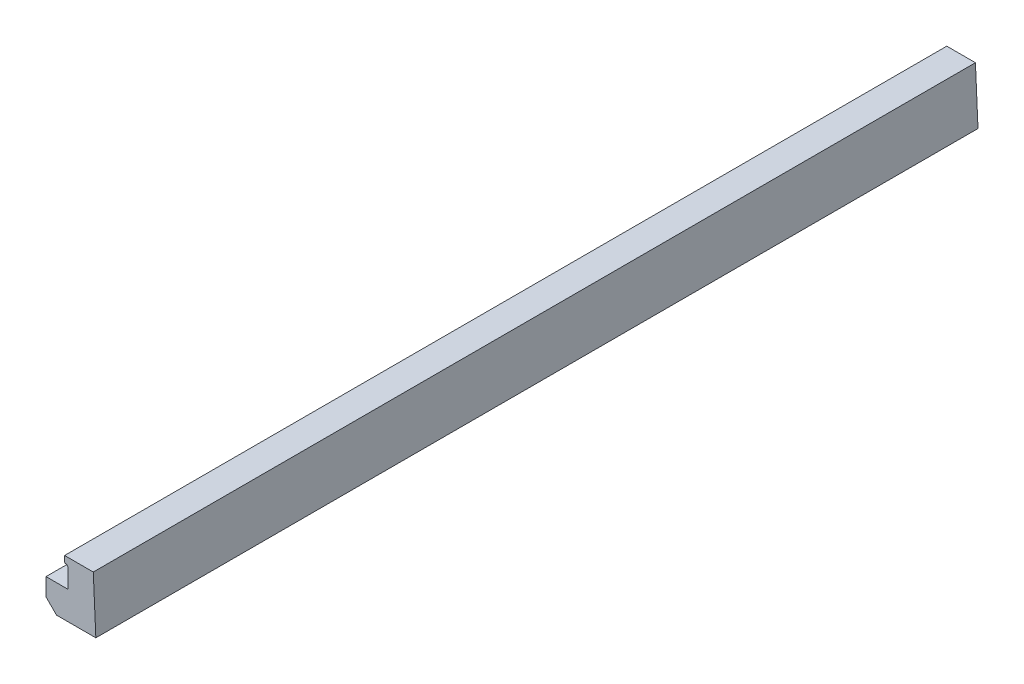
from build123d import *

# Parameters (mm, degrees)
Y_RAIL_SLOT_DEPTH      = 45
Y_RAIL_CONT_DEPTH      = 2
Z_RAIL_SLOT_DEPTH      = 45
X_RAIL_SLOT_DEPTH      = 45
TOLERANCE_START        = -45
TOLERANCE_CUT_Z_DEPTH  = 45
TOLERANCE_CUT_Y_DEPTH  = 135.627263211
TOLERANCE_CUT_X_DEPTH  = 45
SHARP_CORNER_FILLETS_R = 0.2
CUT_EXTRUDE1_DEPTH     = 135.627263211
CUT_EXTRUDE2_START     = -45
CUT_EXTRUDE2_DEPTH     = 45
SKETCH25_W             = 5.05
SKETCH25_H             = 4.200000003
SKETCH25_W_2           = 5.050000001
SKETCH25_H_2           = 4.200000002
SKETCH25_W_3           = 19.75
SKETCH25_H_3           = 19.75
CUT_EXTRUDE3_DEPTH     = 118.874933721
FILLET1_R              = 0.4
CUT_EXTRUDE4_DEPTH     = 118.874933721
BOSS_EXTRUDE1_START    = 109.45
BOSS_EXTRUDE1_DEPTH    = 109.45


with BuildPart() as part:
    # Sketch10 → Y-Rail Slot (new, symmetric)
    with BuildSketch(Plane.XY):
        with BuildLine():
            ThreePointArc((22, -5.8), (22.353553391, -5.946446609), (22.5, -6.3))
            Line((22.5, -6.3), (22.5, -19.5))
            ThreePointArc((22.5, -19.5), (21.621320343, -21.621320344), (19.499999999, -22.500000001))
            Line((19.499999999, -22.500000001), (24.499999999, -22.500000001))
            Line((24.499999999, -22.500000001), (24.499999999, 24.499999999))
            Line((24.499999999, 24.499999999), (-22.500000001, 24.499999999))
            Line((-22.500000001, 24.499999999), (-22.500000001, 19.500000001))
            ThreePointArc((-22.500000001, 19.500000001), (-21.621320345, 21.621320345), (-19.500000001, 22.500000001))
            Line((-19.500000001, 22.500000001), (-6.300000002, 22.500000001))
            ThreePointArc((-6.300000002, 22.500000001), (-5.946446612, 22.353553392), (-5.800000002, 22.000000001))
            Line((-5.800000002, 22.000000001), (-5.800000002, 21.000000004))
            Line((-5.800000002, 21.000000004), (-5.499999997, 21.000000004))
            ThreePointArc((-5.499999997, 21.000000004), (-5.146446607, 20.853553394), (-4.999999997, 20.500000004))
            Line((-4.999999997, 20.500000004), (-4.999999997, 17.525000004))
            ThreePointArc((-4.999999997, 17.525000004), (-5.146446607, 17.171446613), (-5.499999997, 17.025000004))
            Line((-5.499999997, 17.025000004), (-9.549999997, 17.025000004))
            ThreePointArc((-9.549999997, 17.025000004), (-9.903553388, 16.878553395), (-10.049999997, 16.525000004))
            Line((-10.049999997, 16.525000004), (-10.049999997, 11.757106781))
            ThreePointArc((-10.049999997, 11.757106781), (-10.011939764, 11.565765065), (-9.903553388, 11.403553391))
            Line((-9.903553388, 11.403553391), (-6.499999999, 8.000000002))
            Line((-6.499999998, 8.000000003), (2e-09, 8.000000003))
            Line((2e-09, 8.000000003), (6.500000002, 8.000000003))
            Line((6.500000002, 8.000000003), (9.903553392, 11.403553393))
            ThreePointArc((9.903553392, 11.403553393), (10.011939767, 11.565765067), (10.050000001, 11.757106783))
            Line((10.050000001, 11.757106783), (10.050000001, 16.525000003))
            ThreePointArc((10.050000001, 16.525000003), (9.903553392, 16.878553394), (9.550000001, 17.025000003))
            Line((9.550000001, 17.025000003), (5.5, 17.025000003))
            ThreePointArc((5.5, 17.025000003), (5.146446609, 17.171446613), (5, 17.525000003))
            Line((5, 17.525000003), (5, 20.500000003))
            ThreePointArc((5, 20.500000003), (5.146446609, 20.853553393), (5.5, 21.000000003))
            Line((5.5, 21.000000003), (5.800000001, 21.000000003))
            Line((5.800000001, 21.000000003), (5.800000001, 22.000000001))
            ThreePointArc((5.800000001, 22.000000001), (5.94644661, 22.353553392), (6.300000001, 22.500000001))
            Line((6.300000001, 22.500000001), (19.500000001, 22.500000001))
            ThreePointArc((19.500000001, 22.500000001), (21.621320345, 21.621320345), (22.500000001, 19.500000001))
            Line((22.500000001, 19.500000001), (22.500000001, 6.300000002))
            ThreePointArc((22.500000001, 6.300000002), (22.353553392, 5.946446612), (22.000000001, 5.800000002))
            Line((22.000000001, 5.800000002), (21.000000002, 5.800000002))
            Line((21.000000002, 5.800000002), (21.000000002, 5.500000005))
            ThreePointArc((21.000000002, 5.500000005), (20.853553393, 5.146446614), (20.500000002, 5.000000005))
            Line((20.500000002, 5.000000005), (17.525000003, 5.000000005))
            ThreePointArc((17.525000003, 5.000000005), (17.171446612, 5.146446614), (17.025000003, 5.500000005))
            Line((17.025000003, 5.500000005), (17.025000003, 10.050000003))
            Line((17.025000003, 10.050000003), (11.757106782, 10.050000003))
            ThreePointArc((11.757106782, 10.050000003), (11.565765066, 10.011939769), (11.403553391, 9.903553394))
            Line((11.403553391, 9.903553394), (8.000000002, 6.500000004))
            Line((8.000000001, 6.500000005), (8.000000001, 3e-09))
            Line((8.000000001, 3e-09), (8.000000001, -6.499999999))
            Line((8.000000001, -6.499999999), (11.40355339, -9.903553388))
            ThreePointArc((11.40355339, -9.903553388), (11.565765064, -10.011939763), (11.75710678, -10.049999997))
            Line((11.75710678, -10.049999997), (16.525, -10.049999997))
            ThreePointArc((16.525, -10.049999997), (16.878553391, -9.903553388), (17.025000001, -9.549999997))
            Line((17.025000001, -9.549999997), (17.025000001, -5.499999996))
            ThreePointArc((17.025000001, -5.499999996), (17.17144661, -5.146446605), (17.525000001, -4.999999996))
            Line((17.525000001, -4.999999996), (20.5, -4.999999996))
            ThreePointArc((20.5, -4.999999996), (20.853553391, -5.146446605), (21, -5.499999996))
            Line((21, -5.499999996), (21, -5.8))
            Line((21, -5.8), (22, -5.8))
        make_face()
    extrude(amount=Y_RAIL_SLOT_DEPTH, both=True)

    # Sketch12 → Y-Rail cont. (add)
    with BuildSketch(Plane(origin=(0, 0, -45), x_dir=(-1, 0, 0), z_dir=(0, 0, -1))):
        with BuildLine():
            Line((-22.5, -19.5), (-22.5, -6.3))
            ThreePointArc((-22.5, -6.3), (-22.353553391, -5.946446609), (-22, -5.8))
            Line((-22, -5.8), (-21, -5.8))
            Line((-21, -5.8), (-21, -5.499999996))
            ThreePointArc((-21, -5.499999996), (-20.853553391, -5.146446605), (-20.5, -4.999999996))
            Line((-20.5, -4.999999996), (-17.525000001, -4.999999996))
            ThreePointArc((-17.525000001, -4.999999996), (-17.17144661, -5.146446605), (-17.025000001, -5.499999996))
            Line((-17.025000001, -5.499999996), (-17.025000001, -9.549999997))
            ThreePointArc((-17.025000001, -9.549999997), (-16.878553391, -9.903553388), (-16.525, -10.049999997))
            Line((-16.525, -10.049999997), (-11.75710678, -10.049999997))
            ThreePointArc((-11.75710678, -10.049999997), (-11.565765064, -10.011939763), (-11.40355339, -9.903553388))
            Line((-11.40355339, -9.903553388), (-8.000000001, -6.499999999))
            Line((-8.000000001, -6.499999999), (-8.000000001, 6.500000003))
            Line((-8.000000001, 6.500000003), (-11.403553391, 9.903553394))
            ThreePointArc((-11.403553391, 9.903553394), (-11.565765066, 10.011939769), (-11.757106782, 10.050000003))
            Line((-11.757106782, 10.050000003), (-17.025000003, 10.050000003))
            Line((-17.025000003, 10.050000003), (-17.025000003, 5.500000005))
            ThreePointArc((-17.025000003, 5.500000005), (-17.171446612, 5.146446614), (-17.525000003, 5.000000005))
            Line((-17.525000003, 5.000000005), (-20.500000002, 5.000000005))
            ThreePointArc((-20.500000002, 5.000000005), (-20.853553393, 5.146446614), (-21.000000002, 5.500000005))
            Line((-21.000000002, 5.500000005), (-21.000000002, 5.800000002))
            Line((-21.000000002, 5.800000002), (-22.000000001, 5.800000002))
            ThreePointArc((-22.000000001, 5.800000002), (-22.353553392, 5.946446612), (-22.500000001, 6.300000002))
            Line((-22.500000001, 6.300000002), (-22.500000001, 19.500000001))
            ThreePointArc((-22.500000001, 19.500000001), (-21.621320345, 21.621320345), (-19.500000001, 22.500000001))
            Line((-19.500000001, 22.500000001), (-6.300000001, 22.500000001))
            ThreePointArc((-6.300000001, 22.500000001), (-5.94644661, 22.353553392), (-5.800000001, 22.000000001))
            Line((-5.800000001, 22.000000001), (-5.800000001, 21.000000003))
            Line((-5.800000001, 21.000000003), (-5.5, 21.000000003))
            ThreePointArc((-5.5, 21.000000003), (-5.146446609, 20.853553393), (-5, 20.500000003))
            Line((-5, 20.500000003), (-5, 17.525000003))
            ThreePointArc((-5, 17.525000003), (-5.146446609, 17.171446613), (-5.5, 17.025000003))
            Line((-5.5, 17.025000003), (-9.550000001, 17.025000003))
            ThreePointArc((-9.550000001, 17.025000003), (-9.903553392, 16.878553394), (-10.050000001, 16.525000003))
            Line((-10.050000001, 16.525000003), (-10.050000001, 11.757106783))
            ThreePointArc((-10.050000001, 11.757106783), (-10.011939767, 11.565765067), (-9.903553392, 11.403553393))
            Line((-9.903553392, 11.403553393), (-6.500000002, 8.000000003))
            Line((-6.500000002, 8.000000003), (6.5, 8.000000003))
            Line((6.5, 8.000000003), (9.903553388, 11.403553391))
            ThreePointArc((9.903553388, 11.403553391), (10.011939764, 11.565765065), (10.049999997, 11.757106781))
            Line((10.049999997, 11.757106781), (10.049999997, 16.525000004))
            ThreePointArc((10.049999997, 16.525000004), (9.903553388, 16.878553395), (9.549999997, 17.025000004))
            Line((9.549999997, 17.025000004), (5.499999997, 17.025000004))
            ThreePointArc((5.499999997, 17.025000004), (5.146446607, 17.171446613), (4.999999997, 17.525000004))
            Line((4.999999997, 17.525000004), (4.999999997, 20.500000004))
            ThreePointArc((4.999999997, 20.500000004), (5.146446607, 20.853553394), (5.499999997, 21.000000004))
            Line((5.499999997, 21.000000004), (5.800000002, 21.000000004))
            Line((5.800000002, 21.000000004), (5.800000002, 22.000000001))
            ThreePointArc((5.800000002, 22.000000001), (5.946446612, 22.353553392), (6.300000002, 22.500000001))
            Line((6.300000002, 22.500000001), (19.500000001, 22.500000001))
            ThreePointArc((19.500000001, 22.500000001), (21.621320345, 21.621320345), (22.500000001, 19.500000001))
            Line((22.500000001, 19.500000001), (22.500000001, 24.499999999))
            Line((22.500000001, 24.499999999), (-24.499999999, 24.499999999))
            Line((-24.499999999, 24.499999999), (-24.499999999, -22.500000001))
            Line((-24.499999999, -22.500000001), (-19.499999999, -22.500000001))
            ThreePointArc((-19.499999999, -22.500000001), (-21.621320343, -21.621320344), (-22.5, -19.5))
        make_face()
    extrude(amount=Y_RAIL_CONT_DEPTH)

    # Sketch17 → Z-Rail Slot (add)
    with BuildSketch(Plane(origin=(0, 24.499999999, 0), x_dir=(1, 0, 0), z_dir=(0, 1, 0))):
        with BuildLine():
            Line((19.499999999, -45), (24.499999999, -45))
            Line((24.499999999, -45), (24.499999999, 2))
            Line((24.499999999, 2), (-22.500000001, 2))
            Line((-22.500000001, 2), (-22.500000001, -2.999999998))
            ThreePointArc((-22.500000001, -2.999999998), (-21.621320345, -0.878679654), (-19.500000001, 2e-09))
            Line((-19.500000001, 2e-09), (-6.300000002, 2e-09))
            ThreePointArc((-6.300000002, 2e-09), (-5.946446612, -0.146446607), (-5.800000002, -0.499999998))
            Line((-5.800000002, -0.499999998), (-5.800000002, -1.499999995))
            Line((-5.800000002, -1.499999995), (-5.499999997, -1.499999995))
            ThreePointArc((-5.499999997, -1.499999995), (-5.146446607, -1.646446605), (-4.999999997, -1.999999995))
            Line((-4.999999997, -1.999999995), (-4.999999997, -4.974999995))
            ThreePointArc((-4.999999997, -4.974999995), (-5.146446607, -5.328553385), (-5.499999997, -5.474999995))
            Line((-5.499999997, -5.474999995), (-9.549999997, -5.474999995))
            ThreePointArc((-9.549999997, -5.474999995), (-9.903553388, -5.621446604), (-10.049999997, -5.974999995))
            Line((-10.049999997, -5.974999995), (-10.049999997, -10.742893218))
            ThreePointArc((-10.049999997, -10.742893218), (-10.011939764, -10.934234934), (-9.903553388, -11.096446608))
            Line((-9.903553388, -11.096446608), (-6.5, -14.499999996))
            Line((-6.5, -14.499999996), (6.500000002, -14.499999996))
            Line((6.500000002, -14.499999996), (9.903553392, -11.096446606))
            ThreePointArc((9.903553392, -11.096446606), (10.011939767, -10.934234932), (10.050000001, -10.742893216))
            Line((10.050000001, -10.742893216), (10.050000001, -5.974999996))
            ThreePointArc((10.050000001, -5.974999996), (9.903553392, -5.621446605), (9.550000001, -5.474999996))
            Line((9.550000001, -5.474999996), (5.5, -5.474999996))
            ThreePointArc((5.5, -5.474999996), (5.146446609, -5.328553386), (5, -4.974999996))
            Line((5, -4.974999996), (5, -1.999999996))
            ThreePointArc((5, -1.999999996), (5.146446609, -1.646446606), (5.5, -1.499999996))
            Line((5.5, -1.499999996), (5.800000001, -1.499999996))
            Line((5.800000001, -1.499999996), (5.800000001, -0.499999998))
            ThreePointArc((5.800000001, -0.499999998), (5.94644661, -0.146446607), (6.300000001, 2e-09))
            Line((6.300000001, 2e-09), (19.500000001, 2e-09))
            ThreePointArc((19.500000001, 2e-09), (21.621320345, -0.878679654), (22.500000001, -2.999999998))
            Line((22.500000001, -2.999999998), (22.500000001, -16.199999997))
            ThreePointArc((22.500000001, -16.199999997), (22.353553392, -16.553553387), (22.000000001, -16.699999997))
            Line((22.000000001, -16.699999997), (21.000000002, -16.699999997))
            Line((21.000000002, -16.699999997), (21.000000002, -16.999999994))
            ThreePointArc((21.000000002, -16.999999994), (20.853553393, -17.353553385), (20.500000002, -17.499999994))
            Line((20.500000002, -17.499999994), (17.525000003, -17.499999994))
            ThreePointArc((17.525000003, -17.499999994), (17.171446612, -17.353553385), (17.025000003, -16.999999994))
            Line((17.025000003, -16.999999994), (17.025000003, -12.449999996))
            Line((17.025000003, -12.449999996), (11.757106782, -12.449999996))
            ThreePointArc((11.757106782, -12.449999996), (11.565765066, -12.48806023), (11.403553391, -12.596446605))
            Line((11.403553391, -12.596446605), (8.000000001, -15.999999995))
            Line((8.000000001, -15.999999995), (8.000000001, -28.999999998))
            Line((8.000000001, -28.999999998), (11.40355339, -32.403553387))
            ThreePointArc((11.40355339, -32.403553387), (11.565765064, -32.511939762), (11.75710678, -32.549999996))
            Line((11.75710678, -32.549999996), (16.525, -32.549999996))
            ThreePointArc((16.525, -32.549999996), (16.878553391, -32.403553386), (17.025000001, -32.049999996))
            Line((17.025000001, -32.049999996), (17.025000001, -27.999999995))
            ThreePointArc((17.025000001, -27.999999995), (17.17144661, -27.646446604), (17.525000001, -27.499999995))
            Line((17.525000001, -27.499999995), (20.5, -27.499999995))
            ThreePointArc((20.5, -27.499999995), (20.853553391, -27.646446604), (21, -27.999999995))
            Line((21, -27.999999995), (21, -28.299999999))
            Line((21, -28.299999999), (22, -28.299999999))
            ThreePointArc((22, -28.299999999), (22.353553391, -28.446446608), (22.5, -28.799999999))
            Line((22.5, -28.799999999), (22.5, -41.999999999))
            ThreePointArc((22.5, -41.999999999), (21.621320343, -44.121320343), (19.499999999, -45))
        make_face()
    extrude(amount=Z_RAIL_SLOT_DEPTH)

    # Sketch11 → X-Rail Slot (add)
    with BuildSketch(Plane(origin=(24.499999999, 0, 0), x_dir=(0, 0, -1), z_dir=(1, 0, 0))):
        with BuildLine():
            ThreePointArc((16.2, 22.5), (16.553553391, 22.353553391), (16.7, 22))
            Line((16.7, 22), (16.7, 21))
            Line((16.7, 21), (17, 21))
            ThreePointArc((17, 21), (17.353553391, 20.853553391), (17.5, 20.5))
            Line((17.5, 20.5), (17.5, 17.525))
            ThreePointArc((17.5, 17.525), (17.353553391, 17.171446609), (17, 17.025))
            Line((17, 17.025), (12.95, 17.025))
            ThreePointArc((12.95, 17.025), (12.596446609, 16.878553391), (12.45, 16.525))
            Line((12.45, 16.525), (12.45, 11.757106781))
            ThreePointArc((12.45, 11.757106781), (12.488060234, 11.565765065), (12.596446609, 11.403553391))
            Line((12.596446609, 11.403553391), (16, 8))
            Line((16, 8), (22.5, 8))
            Line((22.5, 8), (29, 8))
            Line((29, 8), (32.403553391, 11.403553391))
            ThreePointArc((32.403553391, 11.403553391), (32.511939766, 11.565765065), (32.55, 11.757106781))
            Line((32.55, 11.757106781), (32.55, 17.025))
            Line((32.55, 17.025), (28, 17.025))
            ThreePointArc((28, 17.025), (27.646446609, 17.171446609), (27.5, 17.525))
            Line((27.5, 17.525), (27.5, 20.5))
            ThreePointArc((27.5, 20.5), (27.646446609, 20.853553391), (28, 21))
            Line((28, 21), (28.3, 21))
            Line((28.3, 21), (28.3, 22))
            ThreePointArc((28.3, 22), (28.446446609, 22.353553391), (28.8, 22.5))
            Line((28.8, 22.5), (42, 22.5))
            ThreePointArc((42, 22.5), (44.121320344, 21.621320344), (45, 19.5))
            Line((45, 19.5), (45, 6.3))
            ThreePointArc((45, 6.3), (44.853553391, 5.946446609), (44.5, 5.8))
            Line((44.5, 5.8), (43.5, 5.8))
            Line((43.5, 5.8), (43.5, 5.5))
            ThreePointArc((43.5, 5.5), (43.353553391, 5.146446609), (43, 5))
            Line((43, 5), (40.025, 5))
            ThreePointArc((40.025, 5), (39.671446609, 5.146446609), (39.525, 5.5))
            Line((39.525, 5.5), (39.525, 9.55))
            ThreePointArc((39.525, 9.55), (39.378553391, 9.903553391), (39.025, 10.05))
            Line((39.025, 10.05), (34.257106781, 10.05))
            ThreePointArc((34.257106781, 10.05), (34.065765065, 10.011939766), (33.903553391, 9.903553391))
            Line((33.903553391, 9.903553391), (30.5, 6.5))
            Line((30.5, 6.5), (30.5, 0))
            Line((30.5, 0), (30.5, -6.5))
            Line((30.5, -6.5), (33.903553391, -9.903553391))
            ThreePointArc((33.903553391, -9.903553391), (34.065765065, -10.011939766), (34.257106781, -10.05))
            Line((34.257106781, -10.05), (39.025, -10.05))
            ThreePointArc((39.025, -10.05), (39.378553391, -9.903553391), (39.525, -9.55))
            Line((39.525, -9.55), (39.525, -5.5))
            ThreePointArc((39.525, -5.5), (39.671446609, -5.146446609), (40.025, -5))
            Line((40.025, -5), (43, -5))
            ThreePointArc((43, -5), (43.353553391, -5.146446609), (43.5, -5.5))
            Line((43.5, -5.5), (43.5, -5.8))
            Line((43.5, -5.8), (44.5, -5.8))
            ThreePointArc((44.5, -5.8), (44.853553391, -5.946446609), (45, -6.3))
            Line((45, -6.3), (45, -19.5))
            ThreePointArc((45, -19.5), (44.121320344, -21.621320344), (42, -22.5))
            Line((42, -22.5), (47, -22.500000001))
            Line((47, -22.500000001), (47, 24.499999999))
            Line((47, 24.499999999), (-45, 24.499999999))
            Line((-45, 24.499999999), (-45, 19.5))
            ThreePointArc((-45, 19.5), (-44.121320344, 21.621320344), (-42, 22.5))
            Line((-42, 22.5), (-28.8, 22.5))
            ThreePointArc((-28.8, 22.5), (-28.446446609, 22.353553391), (-28.3, 22))
            Line((-28.3, 22), (-28.3, 21))
            Line((-28.3, 21), (-28, 21))
            ThreePointArc((-28, 21), (-27.646446609, 20.853553391), (-27.5, 20.5))
            Line((-27.5, 20.5), (-27.5, 17.525))
            ThreePointArc((-27.5, 17.525), (-27.646446609, 17.171446609), (-28, 17.025))
            Line((-28, 17.025), (-32.55, 17.025))
            Line((-32.55, 17.025), (-32.55, 11.757106781))
            ThreePointArc((-32.55, 11.757106781), (-32.511939766, 11.565765065), (-32.403553391, 11.403553391))
            Line((-32.403553391, 11.403553391), (-29, 8))
            Line((-29, 8), (-22.5, 8))
            Line((-22.5, 8), (-16, 8))
            Line((-16, 8), (-12.596446609, 11.403553391))
            ThreePointArc((-12.596446609, 11.403553391), (-12.488060234, 11.565765065), (-12.45, 11.757106781))
            Line((-12.45, 11.757106781), (-12.45, 16.525))
            ThreePointArc((-12.45, 16.525), (-12.596446609, 16.878553391), (-12.95, 17.025))
            Line((-12.95, 17.025), (-17, 17.025))
            ThreePointArc((-17, 17.025), (-17.353553391, 17.171446609), (-17.5, 17.525))
            Line((-17.5, 17.525), (-17.5, 20.5))
            ThreePointArc((-17.5, 20.5), (-17.353553391, 20.853553391), (-17, 21))
            Line((-17, 21), (-16.7, 21))
            Line((-16.7, 21), (-16.7, 22))
            ThreePointArc((-16.7, 22), (-16.553553391, 22.353553391), (-16.2, 22.5))
            Line((-16.2, 22.5), (-7.8, 22.5))
            Line((-7.8, 22.5), (-7.8, 21.5))
            ThreePointArc((-7.8, 21.5), (-7.653553391, 21.146446609), (-7.3, 21))
            Line((-7.3, 21), (7.3, 21))
            ThreePointArc((7.3, 21), (7.653553391, 21.146446609), (7.8, 21.5))
            Line((7.8, 21.5), (7.8, 22.5))
            Line((7.8, 22.5), (16.2, 22.5))
        make_face()
    extrude(amount=X_RAIL_SLOT_DEPTH)

    # Sketch20 → Tolerance Cut Z (cut)
    with BuildSketch(Plane(origin=(0, 69.499999999, 0), x_dir=(1, 0, 0), z_dir=(0, 1, 0)).offset(TOLERANCE_START)):
        with BuildLine():
            ThreePointArc((-22.500000001, -2.999999998), (-21.621320345, -0.878679654), (-19.500000001, 2e-09))
            Line((-19.500000001, 2e-09), (-6.300000002, 2e-09))
            ThreePointArc((-6.300000002, 2e-09), (-5.946446612, -0.146446607), (-5.800000002, -0.499999998))
            Line((-5.800000002, -0.499999998), (-5.800000002, -1.499999995))
            Line((-5.800000002, -1.499999995), (-5.499999997, -1.499999995))
            ThreePointArc((-5.499999997, -1.499999995), (-5.146446607, -1.646446605), (-4.999999997, -1.999999995))
            Line((-4.999999997, -1.999999995), (-4.999999997, -4.974999995))
            ThreePointArc((-4.999999997, -4.974999995), (-5.146446607, -5.328553385), (-5.499999997, -5.474999995))
            Line((-5.499999997, -5.474999995), (-9.549999997, -5.474999995))
            ThreePointArc((-9.549999997, -5.474999995), (-9.903553388, -5.621446604), (-10.049999997, -5.974999995))
            Line((-10.049999997, -5.974999995), (-10.049999997, -10.742893218))
            ThreePointArc((-10.049999997, -10.742893218), (-10.011939764, -10.934234934), (-9.903553388, -11.096446608))
            Line((-9.903553388, -11.096446608), (-6.5, -14.499999996))
            Line((-6.5, -14.499999996), (6.500000002, -14.499999996))
            Line((6.500000002, -14.499999996), (9.903553392, -11.096446606))
            ThreePointArc((9.903553392, -11.096446606), (10.011939767, -10.934234932), (10.050000001, -10.742893216))
            Line((10.050000001, -10.742893216), (10.050000001, -5.974999996))
            ThreePointArc((10.050000001, -5.974999996), (9.903553392, -5.621446605), (9.550000001, -5.474999996))
            Line((9.550000001, -5.474999996), (5.5, -5.474999996))
            ThreePointArc((5.5, -5.474999996), (5.146446609, -5.328553386), (5, -4.974999996))
            Line((5, -4.974999996), (5, -1.999999996))
            ThreePointArc((5, -1.999999996), (5.146446609, -1.646446606), (5.5, -1.499999996))
            Line((5.5, -1.499999996), (5.800000001, -1.499999996))
            Line((5.800000001, -1.499999996), (5.800000001, -0.499999998))
            ThreePointArc((5.800000001, -0.499999998), (5.94644661, -0.146446607), (6.300000001, 2e-09))
            Line((6.300000001, 2e-09), (19.500000001, 2e-09))
            ThreePointArc((19.500000001, 2e-09), (21.621320345, -0.878679654), (22.500000001, -2.999999998))
            Line((22.500000001, -2.999999998), (22.500000001, -16.199999997))
            ThreePointArc((22.500000001, -16.199999997), (22.353553392, -16.553553387), (22.000000001, -16.699999997))
            Line((22.000000001, -16.699999997), (21.000000002, -16.699999997))
            Line((21.000000002, -16.699999997), (21.000000002, -16.999999994))
            ThreePointArc((21.000000002, -16.999999994), (20.853553393, -17.353553385), (20.500000002, -17.499999994))
            Line((20.500000002, -17.499999994), (17.525000003, -17.499999994))
            ThreePointArc((17.525000003, -17.499999994), (17.171446612, -17.353553385), (17.025000003, -16.999999994))
            Line((17.025000003, -16.999999994), (17.025000003, -12.449999996))
            Line((17.025000003, -12.449999996), (11.757106782, -12.449999996))
            ThreePointArc((11.757106782, -12.449999996), (11.565765066, -12.48806023), (11.403553391, -12.596446605))
            Line((11.403553391, -12.596446605), (8.000000001, -15.999999995))
            Line((8.000000001, -15.999999995), (8.000000001, -28.999999998))
            Line((8.000000001, -28.999999998), (11.40355339, -32.403553387))
            ThreePointArc((11.40355339, -32.403553387), (11.565765064, -32.511939762), (11.75710678, -32.549999996))
            Line((11.75710678, -32.549999996), (16.525, -32.549999996))
            ThreePointArc((16.525, -32.549999996), (16.878553391, -32.403553386), (17.025000001, -32.049999996))
            Line((17.025000001, -32.049999996), (17.025000001, -27.999999995))
            ThreePointArc((17.025000001, -27.999999995), (17.17144661, -27.646446604), (17.525000001, -27.499999995))
            Line((17.525000001, -27.499999995), (20.5, -27.499999995))
            ThreePointArc((20.5, -27.499999995), (20.853553391, -27.646446604), (21, -27.999999995))
            Line((21, -27.999999995), (21, -28.299999999))
            Line((21, -28.299999999), (22, -28.299999999))
            ThreePointArc((22, -28.299999999), (22.353553391, -28.446446608), (22.5, -28.799999999))
            Line((22.5, -28.799999999), (22.5, -41.999999999))
            ThreePointArc((22.5, -41.999999999), (21.621320343, -44.121320343), (19.499999999, -45))
            Line((19.499999999, -45), (19.499999999, -45.1))
            ThreePointArc((19.499999999, -45.1), (21.692031022, -44.192031021), (22.6, -41.999999999))
            Line((22.6, -41.999999999), (22.6, -28.799999999))
            ThreePointArc((22.6, -28.799999999), (22.424264069, -28.37573593), (22, -28.199999999))
            Line((22, -28.199999999), (21.1, -28.199999999))
            Line((21.1, -28.199999999), (21.1, -27.999999995))
            ThreePointArc((21.1, -27.999999995), (20.924264069, -27.575735926), (20.5, -27.399999995))
            Line((20.5, -27.399999995), (17.525000001, -27.399999995))
            ThreePointArc((17.525000001, -27.399999995), (17.100735932, -27.575735926), (16.925000001, -27.999999995))
            Line((16.925000001, -27.999999995), (16.925000001, -32.049999996))
            ThreePointArc((16.925000001, -32.049999996), (16.807842713, -32.332842708), (16.525, -32.449999996))
            Line((16.525, -32.449999996), (11.75710678, -32.449999996))
            ThreePointArc((11.75710678, -32.449999996), (11.604033408, -32.419551809), (11.474264068, -32.332842709))
            Line((11.474264068, -32.332842709), (8.100000001, -28.958578641))
            Line((8.100000001, -28.958578641), (8.100000001, -16.041421352))
            Line((8.100000001, -16.041421352), (11.474264069, -12.667157283))
            ThreePointArc((11.474264069, -12.667157283), (11.604033409, -12.580448183), (11.757106782, -12.549999996))
            Line((11.757106782, -12.549999996), (16.925000003, -12.549999996))
            Line((16.925000003, -12.549999996), (16.925000003, -16.999999994))
            ThreePointArc((16.925000003, -16.999999994), (17.100735934, -17.424264063), (17.525000003, -17.599999994))
            Line((17.525000003, -17.599999994), (20.500000002, -17.599999994))
            ThreePointArc((20.500000002, -17.599999994), (20.924264071, -17.424264063), (21.100000002, -16.999999994))
            Line((21.100000002, -16.999999994), (21.100000002, -16.799999997))
            Line((21.100000002, -16.799999997), (22.000000001, -16.799999997))
            ThreePointArc((22.000000001, -16.799999997), (22.42426407, -16.624264066), (22.600000001, -16.199999997))
            Line((22.600000001, -16.199999997), (22.600000001, -2.999999998))
            ThreePointArc((22.600000001, -2.999999998), (21.692031023, -0.807968976), (19.500000001, 0.100000002))
            Line((19.500000001, 0.100000002), (6.300000001, 0.100000002))
            ThreePointArc((6.300000001, 0.100000002), (5.875735932, -0.075735929), (5.700000001, -0.499999998))
            Line((5.700000001, -0.499999998), (5.700000001, -1.399999996))
            Line((5.700000001, -1.399999996), (5.5, -1.399999996))
            ThreePointArc((5.5, -1.399999996), (5.075735931, -1.575735927), (4.9, -1.999999996))
            Line((4.9, -1.999999996), (4.9, -4.974999996))
            ThreePointArc((4.9, -4.974999996), (5.075735931, -5.399264064), (5.5, -5.574999996))
            Line((5.5, -5.574999996), (9.550000001, -5.574999996))
            ThreePointArc((9.550000001, -5.574999996), (9.832842713, -5.692157283), (9.950000001, -5.974999996))
            Line((9.950000001, -5.974999996), (9.950000001, -10.742893216))
            ThreePointArc((9.950000001, -10.742893216), (9.919551814, -10.895966589), (9.832842714, -11.025735928))
            Line((9.832842714, -11.025735928), (6.458578646, -14.399999996))
            Line((6.458578646, -14.399999996), (-6.458578644, -14.399999996))
            Line((-6.458578644, -14.399999996), (-9.83284271, -11.02573593))
            ThreePointArc((-9.83284271, -11.02573593), (-9.91955181, -10.89596659), (-9.949999997, -10.742893218))
            Line((-9.949999997, -10.742893218), (-9.949999997, -5.974999995))
            ThreePointArc((-9.949999997, -5.974999995), (-9.83284271, -5.692157282), (-9.549999997, -5.574999995))
            Line((-9.549999997, -5.574999995), (-5.499999997, -5.574999995))
            ThreePointArc((-5.499999997, -5.574999995), (-5.075735928, -5.399264064), (-4.899999997, -4.974999995))
            Line((-4.899999997, -4.974999995), (-4.899999997, -1.999999995))
            ThreePointArc((-4.899999997, -1.999999995), (-5.075735928, -1.575735927), (-5.499999997, -1.399999995))
            Line((-5.499999997, -1.399999995), (-5.700000002, -1.399999995))
            Line((-5.700000002, -1.399999995), (-5.700000002, -0.499999998))
            ThreePointArc((-5.700000002, -0.499999998), (-5.875735933, -0.075735929), (-6.300000002, 0.100000002))
            Line((-6.300000002, 0.100000002), (-19.500000001, 0.100000002))
            ThreePointArc((-19.500000001, 0.100000002), (-21.692031023, -0.807968976), (-22.600000001, -2.999999998))
            Line((-22.600000001, -2.999999998), (-22.500000001, -2.999999998))
        make_face()
    extrude(amount=TOLERANCE_CUT_Z_DEPTH, mode=Mode.SUBTRACT)

    # Sketch21 → Tolerance Cut Y (cut, through all)
    with BuildSketch(Plane.XY.offset(45)):
        with BuildLine():
            ThreePointArc((-22.500000001, 19.500000001), (-21.621320345, 21.621320345), (-19.500000001, 22.500000001))
            Line((-19.500000001, 22.500000001), (-6.300000002, 22.500000001))
            ThreePointArc((-6.300000002, 22.500000001), (-5.946446612, 22.353553392), (-5.800000002, 22.000000001))
            Line((-5.800000002, 22.000000001), (-5.800000002, 21.000000004))
            Line((-5.800000002, 21.000000004), (-5.499999997, 21.000000004))
            ThreePointArc((-5.499999997, 21.000000004), (-5.146446607, 20.853553394), (-4.999999997, 20.500000004))
            Line((-4.999999997, 20.500000004), (-4.999999997, 17.525000004))
            ThreePointArc((-4.999999997, 17.525000004), (-5.146446607, 17.171446613), (-5.499999997, 17.025000004))
            Line((-5.499999997, 17.025000004), (-9.549999997, 17.025000004))
            ThreePointArc((-9.549999997, 17.025000004), (-9.903553388, 16.878553395), (-10.049999997, 16.525000004))
            Line((-10.049999997, 16.525000004), (-10.049999997, 11.757106781))
            ThreePointArc((-10.049999997, 11.757106781), (-10.011939764, 11.565765065), (-9.903553388, 11.403553391))
            Line((-9.903553388, 11.403553391), (-6.5, 8.000000003))
            Line((-6.5, 8.000000003), (6.500000002, 8.000000003))
            Line((6.500000002, 8.000000003), (9.903553392, 11.403553393))
            ThreePointArc((9.903553392, 11.403553393), (10.011939767, 11.565765067), (10.050000001, 11.757106783))
            Line((10.050000001, 11.757106783), (10.050000001, 16.525000003))
            ThreePointArc((10.050000001, 16.525000003), (9.903553392, 16.878553394), (9.550000001, 17.025000003))
            Line((9.550000001, 17.025000003), (5.5, 17.025000003))
            ThreePointArc((5.5, 17.025000003), (5.146446609, 17.171446613), (5, 17.525000003))
            Line((5, 17.525000003), (5, 20.500000003))
            ThreePointArc((5, 20.500000003), (5.146446609, 20.853553393), (5.5, 21.000000003))
            Line((5.5, 21.000000003), (5.800000001, 21.000000003))
            Line((5.800000001, 21.000000003), (5.800000001, 22.000000001))
            ThreePointArc((5.800000001, 22.000000001), (5.94644661, 22.353553392), (6.300000001, 22.500000001))
            Line((6.300000001, 22.500000001), (19.500000001, 22.500000001))
            ThreePointArc((19.500000001, 22.500000001), (21.621320345, 21.621320345), (22.500000001, 19.500000001))
            Line((22.500000001, 19.500000001), (22.500000001, 6.300000002))
            ThreePointArc((22.500000001, 6.300000002), (22.353553392, 5.946446612), (22.000000001, 5.800000002))
            Line((22.000000001, 5.800000002), (21.000000002, 5.800000002))
            Line((21.000000002, 5.800000002), (21.000000002, 5.500000005))
            ThreePointArc((21.000000002, 5.500000005), (20.853553393, 5.146446614), (20.500000002, 5.000000005))
            Line((20.500000002, 5.000000005), (17.525000003, 5.000000005))
            ThreePointArc((17.525000003, 5.000000005), (17.171446612, 5.146446614), (17.025000003, 5.500000005))
            Line((17.025000003, 5.500000005), (17.025000003, 10.050000003))
            Line((17.025000003, 10.050000003), (11.757106782, 10.050000003))
            ThreePointArc((11.757106782, 10.050000003), (11.565765066, 10.011939769), (11.403553391, 9.903553394))
            Line((11.403553391, 9.903553394), (8.000000001, 6.500000003))
            Line((8.000000001, 6.500000003), (8.000000001, -6.499999999))
            Line((8.000000001, -6.499999999), (11.40355339, -9.903553388))
            ThreePointArc((11.40355339, -9.903553388), (11.565765064, -10.011939763), (11.75710678, -10.049999997))
            Line((11.75710678, -10.049999997), (16.525, -10.049999997))
            ThreePointArc((16.525, -10.049999997), (16.878553391, -9.903553388), (17.025000001, -9.549999997))
            Line((17.025000001, -9.549999997), (17.025000001, -5.499999996))
            ThreePointArc((17.025000001, -5.499999996), (17.17144661, -5.146446605), (17.525000001, -4.999999996))
            Line((17.525000001, -4.999999996), (20.5, -4.999999996))
            ThreePointArc((20.5, -4.999999996), (20.853553391, -5.146446605), (21, -5.499999996))
            Line((21, -5.499999996), (21, -5.8))
            Line((21, -5.8), (22, -5.8))
            ThreePointArc((22, -5.8), (22.353553391, -5.946446609), (22.5, -6.3))
            Line((22.5, -6.3), (22.5, -19.5))
            ThreePointArc((22.5, -19.5), (21.621320343, -21.621320344), (19.499999999, -22.500000001))
            Line((19.499999999, -22.500000001), (19.499999999, -22.600000001))
            ThreePointArc((19.499999999, -22.600000001), (21.692031022, -21.692031022), (22.6, -19.5))
            Line((22.6, -19.5), (22.6, -6.3))
            ThreePointArc((22.6, -6.3), (22.424264069, -5.875735931), (22, -5.7))
            Line((22, -5.7), (21.1, -5.7))
            Line((21.1, -5.7), (21.1, -5.499999996))
            ThreePointArc((21.1, -5.499999996), (20.924264069, -5.075735927), (20.5, -4.899999996))
            Line((20.5, -4.899999996), (17.525000001, -4.899999996))
            ThreePointArc((17.525000001, -4.899999996), (17.100735932, -5.075735927), (16.925000001, -5.499999996))
            Line((16.925000001, -5.499999996), (16.925000001, -9.549999997))
            ThreePointArc((16.925000001, -9.549999997), (16.807842713, -9.832842709), (16.525, -9.949999997))
            Line((16.525, -9.949999997), (11.75710678, -9.949999997))
            ThreePointArc((11.75710678, -9.949999997), (11.604033408, -9.91955181), (11.474264068, -9.83284271))
            Line((11.474264068, -9.83284271), (8.100000001, -6.458578642))
            Line((8.100000001, -6.458578642), (8.100000001, 6.458578647))
            Line((8.100000001, 6.458578647), (11.474264069, 9.832842716))
            ThreePointArc((11.474264069, 9.832842716), (11.604033409, 9.919551816), (11.757106782, 9.950000003))
            Line((11.757106782, 9.950000003), (16.925000003, 9.950000003))
            Line((16.925000003, 9.950000003), (16.925000003, 5.500000005))
            ThreePointArc((16.925000003, 5.500000005), (17.100735934, 5.075735936), (17.525000003, 4.900000005))
            Line((17.525000003, 4.900000005), (20.500000002, 4.900000005))
            ThreePointArc((20.500000002, 4.900000005), (20.924264071, 5.075735936), (21.100000002, 5.500000005))
            Line((21.100000002, 5.500000005), (21.100000002, 5.700000002))
            Line((21.100000002, 5.700000002), (22.000000001, 5.700000002))
            ThreePointArc((22.000000001, 5.700000002), (22.42426407, 5.875735933), (22.600000001, 6.300000002))
            Line((22.600000001, 6.300000002), (22.600000001, 19.500000001))
            ThreePointArc((22.600000001, 19.500000001), (21.692031023, 21.692031023), (19.500000001, 22.600000001))
            Line((19.500000001, 22.600000001), (6.300000001, 22.600000001))
            ThreePointArc((6.300000001, 22.600000001), (5.875735932, 22.42426407), (5.700000001, 22.000000001))
            Line((5.700000001, 22.000000001), (5.700000001, 21.100000003))
            Line((5.700000001, 21.100000003), (5.5, 21.100000003))
            ThreePointArc((5.5, 21.100000003), (5.075735931, 20.924264072), (4.9, 20.500000003))
            Line((4.9, 20.500000003), (4.9, 17.525000003))
            ThreePointArc((4.9, 17.525000003), (5.075735931, 17.100735935), (5.5, 16.925000003))
            Line((5.5, 16.925000003), (9.550000001, 16.925000003))
            ThreePointArc((9.550000001, 16.925000003), (9.832842713, 16.807842716), (9.950000001, 16.525000003))
            Line((9.950000001, 16.525000003), (9.950000001, 11.757106783))
            ThreePointArc((9.950000001, 11.757106783), (9.919551814, 11.60403341), (9.832842714, 11.474264071))
            Line((9.832842714, 11.474264071), (6.458578646, 8.100000003))
            Line((6.458578646, 8.100000003), (-6.458578644, 8.100000003))
            Line((-6.458578644, 8.100000003), (-9.83284271, 11.474264069))
            ThreePointArc((-9.83284271, 11.474264069), (-9.91955181, 11.604033408), (-9.949999997, 11.757106781))
            Line((-9.949999997, 11.757106781), (-9.949999997, 16.525000004))
            ThreePointArc((-9.949999997, 16.525000004), (-9.83284271, 16.807842717), (-9.549999997, 16.925000004))
            Line((-9.549999997, 16.925000004), (-5.499999997, 16.925000004))
            ThreePointArc((-5.499999997, 16.925000004), (-5.075735928, 17.100735935), (-4.899999997, 17.525000004))
            Line((-4.899999997, 17.525000004), (-4.899999997, 20.500000004))
            ThreePointArc((-4.899999997, 20.500000004), (-5.075735928, 20.924264072), (-5.499999997, 21.100000004))
            Line((-5.499999997, 21.100000004), (-5.700000002, 21.100000004))
            Line((-5.700000002, 21.100000004), (-5.700000002, 22.000000001))
            ThreePointArc((-5.700000002, 22.000000001), (-5.875735933, 22.42426407), (-6.300000002, 22.600000001))
            Line((-6.300000002, 22.600000001), (-19.500000001, 22.600000001))
            ThreePointArc((-19.500000001, 22.600000001), (-21.692031023, 21.692031023), (-22.600000001, 19.500000001))
            Line((-22.600000001, 19.500000001), (-22.500000001, 19.500000001))
        make_face()
    extrude(amount=-TOLERANCE_CUT_Y_DEPTH, mode=Mode.SUBTRACT)

    # Sketch22 → Tolerance Cut X (cut)
    with BuildSketch(Plane(origin=(69.499999999, 0, 0), x_dir=(0, 0, -1), z_dir=(1, 0, 0)).offset(TOLERANCE_START)):
        with BuildLine():
            ThreePointArc((-45, 19.5), (-44.121320344, 21.621320344), (-42, 22.5))
            Line((-42, 22.5), (-28.8, 22.5))
            ThreePointArc((-28.8, 22.5), (-28.446446609, 22.353553391), (-28.3, 22))
            Line((-28.3, 22), (-28.3, 21))
            Line((-28.3, 21), (-28, 21))
            ThreePointArc((-28, 21), (-27.646446609, 20.853553391), (-27.5, 20.5))
            Line((-27.5, 20.5), (-27.5, 17.525))
            ThreePointArc((-27.5, 17.525), (-27.646446609, 17.171446609), (-28, 17.025))
            Line((-28, 17.025), (-32.55, 17.025))
            Line((-32.55, 17.025), (-32.55, 11.757106781))
            ThreePointArc((-32.55, 11.757106781), (-32.511939766, 11.565765065), (-32.403553391, 11.403553391))
            Line((-32.403553391, 11.403553391), (-29, 8))
            Line((-29, 8), (-16, 8))
            Line((-16, 8), (-12.596446609, 11.403553391))
            ThreePointArc((-12.596446609, 11.403553391), (-12.488060234, 11.565765065), (-12.45, 11.757106781))
            Line((-12.45, 11.757106781), (-12.45, 16.525))
            ThreePointArc((-12.45, 16.525), (-12.596446609, 16.878553391), (-12.95, 17.025))
            Line((-12.95, 17.025), (-17, 17.025))
            ThreePointArc((-17, 17.025), (-17.353553391, 17.171446609), (-17.5, 17.525))
            Line((-17.5, 17.525), (-17.5, 20.5))
            ThreePointArc((-17.5, 20.5), (-17.353553391, 20.853553391), (-17, 21))
            Line((-17, 21), (-16.7, 21))
            Line((-16.7, 21), (-16.7, 22))
            ThreePointArc((-16.7, 22), (-16.553553391, 22.353553391), (-16.2, 22.5))
            Line((-16.2, 22.5), (-7.8, 22.5))
            Line((-7.8, 22.5), (-7.8, 21.5))
            ThreePointArc((-7.8, 21.5), (-7.653553391, 21.146446609), (-7.3, 21))
            Line((-7.3, 21), (7.3, 21))
            ThreePointArc((7.3, 21), (7.653553391, 21.146446609), (7.8, 21.5))
            Line((7.8, 21.5), (7.8, 22.5))
            Line((7.8, 22.5), (16.2, 22.5))
            ThreePointArc((16.2, 22.5), (16.553553391, 22.353553391), (16.7, 22))
            Line((16.7, 22), (16.7, 21))
            Line((16.7, 21), (17, 21))
            ThreePointArc((17, 21), (17.353553391, 20.853553391), (17.5, 20.5))
            Line((17.5, 20.5), (17.5, 17.525))
            ThreePointArc((17.5, 17.525), (17.353553391, 17.171446609), (17, 17.025))
            Line((17, 17.025), (12.95, 17.025))
            ThreePointArc((12.95, 17.025), (12.596446609, 16.878553391), (12.45, 16.525))
            Line((12.45, 16.525), (12.45, 11.757106781))
            ThreePointArc((12.45, 11.757106781), (12.488060234, 11.565765065), (12.596446609, 11.403553391))
            Line((12.596446609, 11.403553391), (16, 8))
            Line((16, 8), (29, 8))
            Line((29, 8), (32.403553391, 11.403553391))
            ThreePointArc((32.403553391, 11.403553391), (32.511939766, 11.565765065), (32.55, 11.757106781))
            Line((32.55, 11.757106781), (32.55, 17.025))
            Line((32.55, 17.025), (28, 17.025))
            ThreePointArc((28, 17.025), (27.646446609, 17.171446609), (27.5, 17.525))
            Line((27.5, 17.525), (27.5, 20.5))
            ThreePointArc((27.5, 20.5), (27.646446609, 20.853553391), (28, 21))
            Line((28, 21), (28.3, 21))
            Line((28.3, 21), (28.3, 22))
            ThreePointArc((28.3, 22), (28.446446609, 22.353553391), (28.8, 22.5))
            Line((28.8, 22.5), (42, 22.5))
            ThreePointArc((42, 22.5), (44.121320344, 21.621320344), (45, 19.5))
            Line((45, 19.5), (45, 6.3))
            ThreePointArc((45, 6.3), (44.853553391, 5.946446609), (44.5, 5.8))
            Line((44.5, 5.8), (43.5, 5.8))
            Line((43.5, 5.8), (43.5, 5.5))
            ThreePointArc((43.5, 5.5), (43.353553391, 5.146446609), (43, 5))
            Line((43, 5), (40.025, 5))
            ThreePointArc((40.025, 5), (39.671446609, 5.146446609), (39.525, 5.5))
            Line((39.525, 5.5), (39.525, 9.55))
            ThreePointArc((39.525, 9.55), (39.378553391, 9.903553391), (39.025, 10.05))
            Line((39.025, 10.05), (34.257106781, 10.05))
            ThreePointArc((34.257106781, 10.05), (34.065765065, 10.011939766), (33.903553391, 9.903553391))
            Line((33.903553391, 9.903553391), (30.5, 6.5))
            Line((30.5, 6.5), (30.5, -6.5))
            Line((30.5, -6.5), (33.903553391, -9.903553391))
            ThreePointArc((33.903553391, -9.903553391), (34.065765065, -10.011939766), (34.257106781, -10.05))
            Line((34.257106781, -10.05), (39.025, -10.05))
            ThreePointArc((39.025, -10.05), (39.378553391, -9.903553391), (39.525, -9.55))
            Line((39.525, -9.55), (39.525, -5.5))
            ThreePointArc((39.525, -5.5), (39.671446609, -5.146446609), (40.025, -5))
            Line((40.025, -5), (43, -5))
            ThreePointArc((43, -5), (43.353553391, -5.146446609), (43.5, -5.5))
            Line((43.5, -5.5), (43.5, -5.8))
            Line((43.5, -5.8), (44.5, -5.8))
            ThreePointArc((44.5, -5.8), (44.853553391, -5.946446609), (45, -6.3))
            Line((45, -6.3), (45.000000001, -19.5))
            ThreePointArc((45.000000001, -19.5), (44.121320344, -21.621320344), (42, -22.500000001))
            Line((42, -22.500000001), (42, -22.600000001))
            ThreePointArc((42, -22.600000001), (44.192031022, -21.692031022), (45.100000001, -19.5))
            Line((45.100000001, -19.5), (45.1, -6.3))
            ThreePointArc((45.1, -6.3), (44.924264069, -5.875735931), (44.5, -5.7))
            Line((44.5, -5.7), (43.6, -5.7))
            Line((43.6, -5.7), (43.6, -5.5))
            ThreePointArc((43.6, -5.5), (43.424264069, -5.075735931), (43, -4.9))
            Line((43, -4.9), (40.025, -4.9))
            ThreePointArc((40.025, -4.9), (39.600735931, -5.075735931), (39.425, -5.5))
            Line((39.425, -5.5), (39.425, -9.55))
            ThreePointArc((39.425, -9.55), (39.307842712, -9.832842712), (39.025, -9.95))
            Line((39.025, -9.95), (34.257106781, -9.95))
            ThreePointArc((34.257106781, -9.95), (34.104033408, -9.919551813), (33.974264069, -9.832842712))
            Line((33.974264069, -9.832842712), (30.6, -6.458578644))
            Line((30.6, -6.458578644), (30.6, 6.458578644))
            Line((30.6, 6.458578644), (33.974264069, 9.832842713))
            ThreePointArc((33.974264069, 9.832842713), (34.104033408, 9.919551813), (34.257106781, 9.95))
            Line((34.257106781, 9.95), (39.025, 9.95))
            ThreePointArc((39.025, 9.95), (39.307842712, 9.832842713), (39.425, 9.55))
            Line((39.425, 9.55), (39.425, 5.5))
            ThreePointArc((39.425, 5.5), (39.600735931, 5.075735931), (40.025, 4.9))
            Line((40.025, 4.9), (43, 4.9))
            ThreePointArc((43, 4.9), (43.424264069, 5.075735931), (43.6, 5.5))
            Line((43.6, 5.5), (43.6, 5.7))
            Line((43.6, 5.7), (44.5, 5.7))
            ThreePointArc((44.5, 5.7), (44.924264069, 5.875735931), (45.1, 6.3))
            Line((45.1, 6.3), (45.1, 19.5))
            ThreePointArc((45.1, 19.5), (44.192031022, 21.692031022), (42, 22.6))
            Line((42, 22.6), (28.8, 22.6))
            ThreePointArc((28.8, 22.6), (28.375735931, 22.424264069), (28.2, 22))
            Line((28.2, 22), (28.2, 21.1))
            Line((28.2, 21.1), (28, 21.1))
            ThreePointArc((28, 21.1), (27.575735931, 20.924264069), (27.4, 20.5))
            Line((27.4, 20.5), (27.4, 17.525))
            ThreePointArc((27.4, 17.525), (27.575735931, 17.100735931), (28, 16.925))
            Line((28, 16.925), (32.45, 16.925))
            Line((32.45, 16.925), (32.45, 11.757106781))
            ThreePointArc((32.45, 11.757106781), (32.419551813, 11.604033408), (32.332842712, 11.474264069))
            Line((32.332842712, 11.474264069), (28.958578644, 8.1))
            Line((28.958578644, 8.1), (16.041421356, 8.1))
            Line((16.041421356, 8.1), (12.667157288, 11.474264069))
            ThreePointArc((12.667157288, 11.474264069), (12.580448187, 11.604033408), (12.55, 11.757106781))
            Line((12.55, 11.757106781), (12.55, 16.525))
            ThreePointArc((12.55, 16.525), (12.667157288, 16.807842713), (12.95, 16.925))
            Line((12.95, 16.925), (17, 16.925))
            ThreePointArc((17, 16.925), (17.424264069, 17.100735931), (17.6, 17.525))
            Line((17.6, 17.525), (17.6, 20.5))
            ThreePointArc((17.6, 20.5), (17.424264069, 20.924264069), (17, 21.1))
            Line((17, 21.1), (16.8, 21.1))
            Line((16.8, 21.1), (16.8, 22))
            ThreePointArc((16.8, 22), (16.624264069, 22.424264069), (16.2, 22.6))
            Line((16.2, 22.6), (7.7, 22.6))
            Line((7.7, 22.6), (7.7, 21.5))
            ThreePointArc((7.7, 21.5), (7.582842712, 21.217157288), (7.3, 21.1))
            Line((7.3, 21.1), (-7.3, 21.1))
            ThreePointArc((-7.3, 21.1), (-7.582842712, 21.217157288), (-7.7, 21.5))
            Line((-7.7, 21.5), (-7.7, 22.6))
            Line((-7.7, 22.6), (-16.2, 22.6))
            ThreePointArc((-16.2, 22.6), (-16.624264069, 22.424264069), (-16.8, 22))
            Line((-16.8, 22), (-16.8, 21.1))
            Line((-16.8, 21.1), (-17, 21.1))
            ThreePointArc((-17, 21.1), (-17.424264069, 20.924264069), (-17.6, 20.5))
            Line((-17.6, 20.5), (-17.6, 17.525))
            ThreePointArc((-17.6, 17.525), (-17.424264069, 17.100735931), (-17, 16.925))
            Line((-17, 16.925), (-12.95, 16.925))
            ThreePointArc((-12.95, 16.925), (-12.667157288, 16.807842712), (-12.55, 16.525))
            Line((-12.55, 16.525), (-12.55, 11.757106781))
            ThreePointArc((-12.55, 11.757106781), (-12.580448187, 11.604033408), (-12.667157288, 11.474264069))
            Line((-12.667157288, 11.474264069), (-16.041421356, 8.1))
            Line((-16.041421356, 8.1), (-28.958578644, 8.1))
            Line((-28.958578644, 8.1), (-32.332842712, 11.474264069))
            ThreePointArc((-32.332842712, 11.474264069), (-32.419551813, 11.604033408), (-32.45, 11.757106781))
            Line((-32.45, 11.757106781), (-32.45, 16.925))
            Line((-32.45, 16.925), (-28, 16.925))
            ThreePointArc((-28, 16.925), (-27.575735931, 17.100735931), (-27.4, 17.525))
            Line((-27.4, 17.525), (-27.4, 20.5))
            ThreePointArc((-27.4, 20.5), (-27.575735931, 20.924264069), (-28, 21.1))
            Line((-28, 21.1), (-28.2, 21.1))
            Line((-28.2, 21.1), (-28.2, 22))
            ThreePointArc((-28.2, 22), (-28.375735931, 22.424264069), (-28.8, 22.6))
            Line((-28.8, 22.6), (-42, 22.6))
            ThreePointArc((-42, 22.6), (-44.192031022, 21.692031022), (-45.1, 19.5))
            Line((-45.1, 19.5), (-45, 19.5))
        make_face()
    extrude(amount=TOLERANCE_CUT_X_DEPTH, mode=Mode.SUBTRACT)

    # Sharp Corner Fillets
    # the kernel refuses this fillet: 0.2 mm, written as the material it takes off along each edge
    with BuildSketch(Plane(origin=(21.100000002, 24.499999999, 16.799999997), x_dir=(1, 0, 0), z_dir=(0, 1, 0)), Plane(origin=(21.1, 24.499999999, 28.199999999), x_dir=(0, 0, -1), z_dir=(0, 1, 0)), Plane(origin=(5.700000001, 24.499999999, 1.399999996), x_dir=(-1, 0, 0), z_dir=(0, 1, 0)), Plane(origin=(-5.700000002, 24.499999999, 1.399999995), x_dir=(0, 0, -1), z_dir=(0, 1, 0))) as sharp_corner_fillets_piece_1:
        with BuildLine():
            CenterArc((SHARP_CORNER_FILLETS_R, -SHARP_CORNER_FILLETS_R), SHARP_CORNER_FILLETS_R, 90, 90)
            Line((0, -SHARP_CORNER_FILLETS_R), (0, 0))
            Line((0, 0), (SHARP_CORNER_FILLETS_R, 0))
        make_face()
    extrude(amount=45.5, mode=Mode.SUBTRACT)
    with BuildSketch(Plane(origin=(-22.500000001, 71.913499879, 2.21897503), x_dir=(0, 0, -1), z_dir=(0, -1, 0)), Plane(origin=(71.913499879, 20.281024968, 45), x_dir=(0, 1, 0), z_dir=(-1, 0, 0))) as sharp_corner_fillets_piece_2:
        with BuildLine():
            CenterArc((0.965399952, 0.2), SHARP_CORNER_FILLETS_R, 121.9527464, 148.0472536)
            ThreePointArc((0.859556018, 0.36969697), (0.44380678, 0.152231191), (0, 0))
            Line((0, 0), (0.965399952, 0))
        make_face()
    extrude(amount=47.41349988, mode=Mode.SUBTRACT)
    with BuildSketch(Plane(origin=(20.281024967, 71.91349988, 45), x_dir=(1, 0, 0), z_dir=(0, -1, 0))) as sharp_corner_fillets_piece_3:
        with BuildLine():
            CenterArc((0.965399952, -0.2), SHARP_CORNER_FILLETS_R, 90, 148.047253605)
            ThreePointArc((0.859556018, -0.36969697), (0.44380678, -0.152231191), (0, 0))
            Line((0, 0), (0.965399952, 0))
        make_face()
    extrude(amount=47.413499881, mode=Mode.SUBTRACT)
    with BuildSketch(Plane(origin=(21.1, -5.7, 45.5), x_dir=(1, 0, 0), z_dir=(0, 0, -1)), Plane(origin=(21.100000002, 5.700000002, 45.5), x_dir=(0, -1, 0), z_dir=(0, 0, -1)), Plane(origin=(5.700000001, 21.100000003, 45.5), x_dir=(0, 1, 0), z_dir=(0, 0, -1)), Plane(origin=(-5.700000002, 21.100000004, 45.5), x_dir=(1, 0, 0), z_dir=(0, 0, -1))) as sharp_corner_fillets_piece_4:
        with BuildLine():
            CenterArc((SHARP_CORNER_FILLETS_R, -SHARP_CORNER_FILLETS_R), SHARP_CORNER_FILLETS_R, 90, 90)
            Line((0, -SHARP_CORNER_FILLETS_R), (0, 0))
            Line((0, 0), (SHARP_CORNER_FILLETS_R, 0))
        make_face()
    extrude(amount=93, mode=Mode.SUBTRACT)
    with BuildSketch(Plane(origin=(-22.500000001, 20.281024969, -49.41349988), x_dir=(0.3951070153532721, 0.9186350997096885, 0), z_dir=(0, 0, 1))) as sharp_corner_fillets_piece_5:
        with BuildLine():
            CenterArc((0.965871684, 0.197709274), SHARP_CORNER_FILLETS_R, 113.272648501, 148.0472536)
            Line((0.886850281, 0.381436294), (0, 0))
            ThreePointArc((0, 0), (0.467844097, 0.035506257), (0.935688194, 0))
        make_face()
    extrude(amount=96.82699976, mode=Mode.SUBTRACT)
    with BuildSketch(Plane(origin=(20.281024967, -22.500000001, -49.413499881), x_dir=(1, 0, 0), z_dir=(0, 0, 1))) as sharp_corner_fillets_piece_6:
        with BuildLine():
            CenterArc((0.965399952, 0.2), SHARP_CORNER_FILLETS_R, 121.952746395, 148.047253605)
            ThreePointArc((0.859556018, 0.36969697), (0.44380678, 0.152231191), (0, 0))
            Line((0, 0), (0.965399952, 0))
        make_face()
    extrude(amount=96.826999761, mode=Mode.SUBTRACT)
    with BuildSketch(Plane(origin=(71.913499873, -22.5, -42.781024971), x_dir=(0, -2.099979945321112e-10, -1.0), z_dir=(-1, 0, 0))) as sharp_corner_fillets_piece_7:
        with BuildLine():
            CenterArc((0.96539995, -0.2), SHARP_CORNER_FILLETS_R, 90, 148.047253566)
            ThreePointArc((0.859556015, -0.36969697), (0.443806779, -0.152231191), (0, 0))
            Line((0, 0), (0.96539995, 0))
        make_face()
    extrude(amount=47.413499874, mode=Mode.SUBTRACT)
    with BuildSketch(Plane(origin=(24.499999999, -5.7, -43.6), x_dir=(0, 0, -1), z_dir=(1, 0, 0)), Plane(origin=(24.499999999, 5.7, -43.6), x_dir=(0, -1, 0), z_dir=(1, 0, 0)), Plane(origin=(24.499999999, 21.1, -28.2), x_dir=(0, 1, 0), z_dir=(1, 0, 0)), Plane(origin=(24.499999999, 21.1, -16.8), x_dir=(0, 0, -1), z_dir=(1, 0, 0)), Plane(origin=(24.499999999, 21.1, 16.8), x_dir=(0, 1, 0), z_dir=(1, 0, 0)), Plane(origin=(24.499999999, 21.1, 28.2), x_dir=(0, 0, -1), z_dir=(1, 0, 0))) as sharp_corner_fillets_piece_8:
        with BuildLine():
            CenterArc((SHARP_CORNER_FILLETS_R, SHARP_CORNER_FILLETS_R), SHARP_CORNER_FILLETS_R, 180, 90)
            Line((0, SHARP_CORNER_FILLETS_R), (0, 0))
            Line((0, 0), (SHARP_CORNER_FILLETS_R, 0))
        make_face()
    extrude(amount=45.5, mode=Mode.SUBTRACT)

    # Sketch23 → Cut-Extrude1 (cut, through all)
    with BuildSketch(Plane.XY.offset(45)):
        Polygon((24.499999999, 24.499999999), (0, 0), (0, -22.500000001), (69.499999999, -22.500000001), (69.499999999, 24.499999999), align=None)
    extrude(amount=-CUT_EXTRUDE1_DEPTH, mode=Mode.SUBTRACT)

    # Sketch24 → Cut-Extrude2 (cut)
    with BuildSketch(Plane(origin=(0, 69.499999999, 0), x_dir=(1, 0, 0), z_dir=(0, 1, 0)).offset(CUT_EXTRUDE2_START)):
        with BuildLine():
            Line((-4.899999997, -6.199999998), (-4.899999997, -4.974999995))
            ThreePointArc((-4.899999997, -4.974999995), (-5.075735928, -5.399264064), (-5.499999997, -5.574999995))
            Line((-5.499999997, -5.574999995), (-9.549999997, -5.574999995))
            ThreePointArc((-9.549999997, -5.574999995), (-9.83284271, -5.692157282), (-9.949999997, -5.974999995))
            Line((-9.949999997, -5.974999995), (-9.949999997, -6.199999998))
            Line((-9.949999997, -6.199999998), (-4.899999997, -6.199999998))
        make_face()
        with BuildLine():
            Line((-9.949999997, -10.216547618), (-9.949999997, -10.742893218))
            ThreePointArc((-9.949999997, -10.742893218), (-9.91955181, -10.89596659), (-9.83284271, -11.02573593))
            Line((-9.83284271, -11.02573593), (-6.458578644, -14.399999996))
            Line((-6.458578644, -14.399999996), (6.458578646, -14.399999996))
            Line((6.458578646, -14.399999996), (9.832842714, -11.025735928))
            ThreePointArc((9.832842714, -11.025735928), (9.919551814, -10.895966589), (9.950000001, -10.742893216))
            Line((9.950000001, -10.742893216), (9.950000001, -10.216547618))
            Line((9.950000001, -10.216547618), (7.54154762, -12.624999999))
            Line((7.54154762, -12.624999999), (-7.54154762, -12.624999999))
            Line((-7.54154762, -12.624999999), (-9.950000001, -10.216547618))
        make_face()
        with BuildLine():
            Line((12.283452379, -12.549999996), (11.757106782, -12.549999996))
            ThreePointArc((11.757106782, -12.549999996), (11.604033409, -12.580448183), (11.474264069, -12.667157283))
            Line((11.474264069, -12.667157283), (8.100000001, -16.041421352))
            Line((8.100000001, -16.041421352), (8.100000001, -28.266547624))
            Line((8.100000001, -28.266547624), (8.100000001, -28.958578641))
            Line((8.100000001, -28.958578641), (11.474264068, -32.332842709))
            ThreePointArc((11.474264068, -32.332842709), (11.604033408, -32.419551809), (11.75710678, -32.449999996))
            Line((11.75710678, -32.449999996), (12.283452379, -32.449999996))
            Line((12.283452379, -32.450000002), (9.875, -30.041547623))
            Line((9.875, -30.041547623), (9.875, -14.958452375))
            Line((9.875, -14.958452375), (12.283452379, -12.549999996))
        make_face()
        with BuildLine():
            Line((4.9, -6.199999998), (9.950000001, -6.199999998))
            Line((9.950000001, -6.199999998), (9.950000001, -5.974999996))
            ThreePointArc((9.950000001, -5.974999996), (9.832842713, -5.692157283), (9.550000001, -5.574999996))
            Line((9.550000001, -5.574999996), (5.5, -5.574999996))
            ThreePointArc((5.5, -5.574999996), (5.075735931, -5.399264064), (4.9, -4.974999996))
            Line((4.9, -4.974999996), (4.9, -6.199999998))
        make_face()
        with BuildLine():
            Line((16.925000003, -12.549999998), (16.300000001, -12.549999998))
            Line((16.300000001, -12.549999998), (16.300000001, -17.599999999))
            Line((16.300000001, -17.599999999), (17.525000003, -17.599999999))
            ThreePointArc((17.525000003, -17.599999994), (17.100735934, -17.424264063), (16.925000003, -16.999999994))
            Line((16.925000003, -16.999999994), (16.925000003, -12.549999996))
        make_face()
        with BuildLine():
            Line((16.300000001, -27.399999996), (16.300000001, -32.449999996))
            Line((16.300000001, -32.449999996), (16.525, -32.449999996))
            ThreePointArc((16.525, -32.449999996), (16.807842713, -32.332842708), (16.925000001, -32.049999996))
            Line((16.925000001, -32.049999996), (16.925000001, -27.999999995))
            ThreePointArc((16.925000001, -27.999999995), (17.100735932, -27.575735926), (17.525000001, -27.399999995))
            Line((17.525000001, -27.399999996), (16.300000001, -27.399999996))
        make_face()
    extrude(amount=CUT_EXTRUDE2_DEPTH, mode=Mode.SUBTRACT)

    # Sketch25 → Cut-Extrude3 (cut, through all)
    with BuildSketch(Plane.XY.offset(45)):
        with Locations((-7.424999997, 18.400000003)):
            Rectangle(SKETCH25_W, SKETCH25_H)
        with Locations((7.425000001, 18.400000002)):
            Rectangle(SKETCH25_W_2, SKETCH25_H_2)
        Polygon((9.950000001, 12.283452379), (12.283452379, 9.950000001), (8.100000003, 5.766547625), (5.766547625, 8.100000003), align=None)
        Rectangle(SKETCH25_W_3, SKETCH25_H_3)
        Polygon((-12.283452379, 9.950000001), (-8.100000003, 5.766547625), (-5.766547625, 8.100000003), (-9.950000001, 12.283452379), align=None)
    extrude(amount=-CUT_EXTRUDE3_DEPTH, mode=Mode.SUBTRACT)

    # Fillet1
    fillet1_edges = [part.edges().sort_by_distance(p)[0] for p in [
        (9.950000001, 46.999999999, 6.199999998),
        (16.300000001, 46.999999999, 32.449999996),
        (16.300000001, 46.999999999, 12.549999998),
        (9.875, 46.999999999, 14.958452375),
        (12.283452379, 46.999999999, 12.549999996),
        (9.950000001, 46.999999999, 10.216547618),
        (7.54154762, 46.999999999, 12.624999999),
        (12.283452379, 46.999999999, 32.449999999),
        (9.875, 46.999999999, 30.041547623),
        (-7.54154762, 46.999999999, 12.624999999),
        (-9.949999999, 46.999999999, 10.216547618),
        (-9.949999997, 46.999999999, 6.199999998),
    ]]
    fillet(fillet1_edges, radius=FILLET1_R)

    # Sketch26 → Cut-Extrude4 (cut, through all)
    with BuildSketch(Plane.XY.offset(45)):
        Polygon((-22.500000001, 69.499999999), (-22.500000001, 16.300000001), (-5.700000002, 22.000000001), (-5.700000002, 22.600000001), (0.845499998, 22.600000001), (1.432241195, 9.875), (24.499999999, 9.875), (24.499999999, 69.499999999), align=None)
    extrude(amount=-CUT_EXTRUDE4_DEPTH, mode=Mode.SUBTRACT)

    # Sketch27 → Boss-Extrude1 (add)
    with BuildSketch(Plane.XY.offset(45).offset(BOSS_EXTRUDE1_START)):
        with BuildLine():
            Line((1.432241195, 9.875), (0.845499998, 22.600000001))
            Line((0.845499998, 22.600000001), (-5.700000002, 22.600000001))
            Line((-5.700000002, 22.600000001), (-5.700000002, 21.300000004))
            ThreePointArc((-5.700000002, 21.300000004), (-5.641421357, 21.158578646), (-5.499999997, 21.100000004))
            ThreePointArc((-5.499999997, 21.100000004), (-5.075735928, 20.924264072), (-4.899999997, 20.500000004))
            Line((-4.899999997, 20.500000004), (-4.899999997, 16.300000001))
            Line((-4.899999997, 16.300000001), (-9.949999997, 16.300000001))
            Line((-9.949999997, 16.300000001), (-9.950000001, 12.283452379))
            Line((-9.950000001, 12.283452379), (-7.541547622, 9.875))
            Line((-7.541547622, 9.875), (1.432241195, 9.875))
        make_face()
    extrude(amount=-BOSS_EXTRUDE1_DEPTH)


solid = part.part
